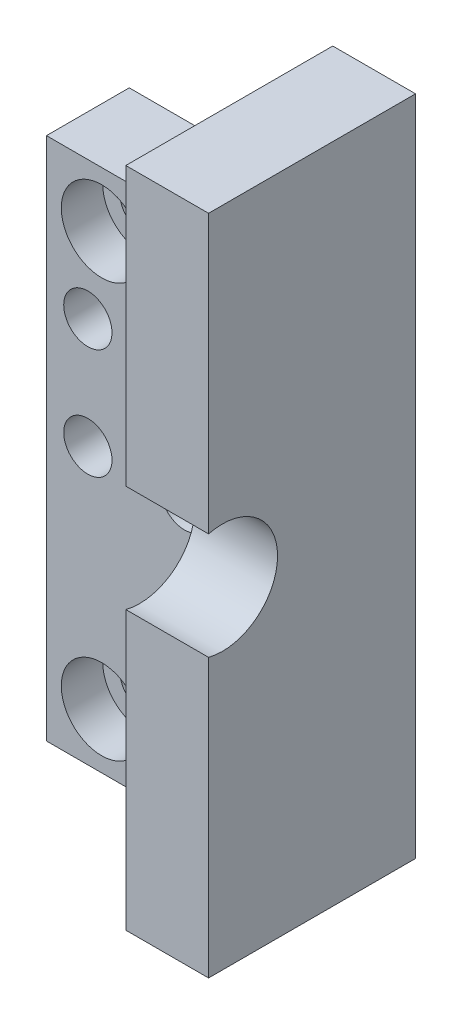
from build123d import *

# Parameters (mm, degrees)
SKETCH1_W           = 20.75
SKETCH1_H           = 48
SKETCH1_R           = 1.675
BOSS_EXTRUDE1_DEPTH = 6
SKETCH2_W           = 15
SKETCH2_H           = 48
BOSS_EXTRUDE2_DEPTH = 6
SKETCH3_R           = 4
CUT_EXTRUDE1_DEPTH  = 6
SKETCH5_R           = 2.925
CUT_EXTRUDE2_DEPTH  = 3
SKETCH6_R           = 1.75
CUT_EXTRUDE3_DEPTH  = 10
SKETCH7_W           = 3.5
SKETCH7_H           = 8
CUT_EXTRUDE4_DEPTH  = 2.5
SKETCH8_W           = 14.75
SKETCH8_H           = 10
CUT_EXTRUDE5_DEPTH  = 16
SKETCH9_W           = 15
SKETCH9_H           = 48
CUT_EXTRUDE6_DEPTH  = 20.75


with BuildPart() as part:
    # Sketch1 → Boss-Extrude1 (new body)
    with BuildSketch(Plane.XY):
        with Locations((10.375, 24)):
            Rectangle(SKETCH1_W, SKETCH1_H)
        with Locations((16.75, 34)):
            Circle(SKETCH1_R, mode=Mode.SUBTRACT)
        with Locations((16.75, 4)):
            Circle(SKETCH1_R, mode=Mode.SUBTRACT)
    boss_extrude1 = extrude(amount=BOSS_EXTRUDE1_DEPTH)

    # Sketch2 → Boss-Extrude2 (add)
    with BuildSketch(Plane.ZY):
        with Locations((7.5, 24)):
            Rectangle(SKETCH2_W, SKETCH2_H)
    boss_extrude2 = extrude(amount=-BOSS_EXTRUDE2_DEPTH)

    # Sketch3 → Cut-Extrude1 (cut)
    with BuildSketch(Plane.ZY):
        with Locations((14, 24)):
            Circle(SKETCH3_R)
    cut_extrude1 = extrude(amount=-CUT_EXTRUDE1_DEPTH, mode=Mode.SUBTRACT)

    # Sketch5 → Cut-Extrude2 (cut)
    with BuildSketch(Plane.XY.offset(6)):
        with Locations((16.75, 34)):
            Circle(SKETCH5_R)
        with Locations((16.75, 4)):
            Circle(SKETCH5_R)
    cut_extrude2 = extrude(amount=-CUT_EXTRUDE2_DEPTH, mode=Mode.SUBTRACT)

    # Sketch6 → Cut-Extrude3 (cut)
    with BuildSketch(Plane.XY.offset(6)):
        with Locations((10.75, 28)):
            Circle(SKETCH6_R)
        with Locations((17.75, 28)):
            Circle(SKETCH6_R)
        with Locations((10.75, 20)):
            Circle(SKETCH6_R)
        with Locations((17.75, 20)):
            Circle(SKETCH6_R)
    cut_extrude3 = extrude(amount=-CUT_EXTRUDE3_DEPTH, mode=Mode.SUBTRACT)

    # Sketch7 → Cut-Extrude4 (cut)
    with BuildSketch(Plane(origin=(0, 0, 0), x_dir=(-1, 0, 0), z_dir=(0, 0, -1))):
        with Locations((-17.75, 24)):
            Rectangle(SKETCH7_W, SKETCH7_H)
        with Locations((-10.75, 24)):
            Rectangle(SKETCH7_W, SKETCH7_H)
    cut_extrude4 = extrude(amount=-CUT_EXTRUDE4_DEPTH, mode=Mode.SUBTRACT)

    # Sketch8 → Cut-Extrude5 (cut)
    with BuildSketch(Plane.XY.offset(6)):
        with Locations((13.375, 43)):
            Rectangle(SKETCH8_W, SKETCH8_H)
    cut_extrude5 = extrude(amount=-CUT_EXTRUDE5_DEPTH, mode=Mode.SUBTRACT)

    # Mirror3: Boss-Extrude1, Boss-Extrude2, Cut-Extrude1, Cut-Extrude2, Cut-Extrude3, Cut-Extrude4, Cut-Extrude5 across plane
    add(boss_extrude1.mirror(Plane(origin=(20.75, 0, 6), x_dir=(0, 0, 1), z_dir=(-1, 0, 0))))
    add(boss_extrude2.mirror(Plane(origin=(20.75, 0, 6), x_dir=(0, 0, 1), z_dir=(-1, 0, 0))))
    add(cut_extrude1.mirror(Plane(origin=(20.75, 0, 6), x_dir=(0, 0, 1), z_dir=(-1, 0, 0))), mode=Mode.SUBTRACT)
    add(cut_extrude2.mirror(Plane(origin=(20.75, 0, 6), x_dir=(0, 0, 1), z_dir=(-1, 0, 0))), mode=Mode.SUBTRACT)
    add(cut_extrude3.mirror(Plane(origin=(20.75, 0, 6), x_dir=(0, 0, 1), z_dir=(-1, 0, 0))), mode=Mode.SUBTRACT)
    add(cut_extrude4.mirror(Plane(origin=(20.75, 0, 6), x_dir=(0, 0, 1), z_dir=(-1, 0, 0))), mode=Mode.SUBTRACT)
    add(cut_extrude5.mirror(Plane(origin=(20.75, 0, 6), x_dir=(0, 0, 1), z_dir=(-1, 0, 0))), mode=Mode.SUBTRACT)

    # Sketch9 → Cut-Extrude6 (cut)
    with BuildSketch(Plane.ZY):
        with Locations((7.5, 24)):
            Rectangle(SKETCH9_W, SKETCH9_H)
    extrude(amount=-CUT_EXTRUDE6_DEPTH, mode=Mode.SUBTRACT)


solid = part.part
